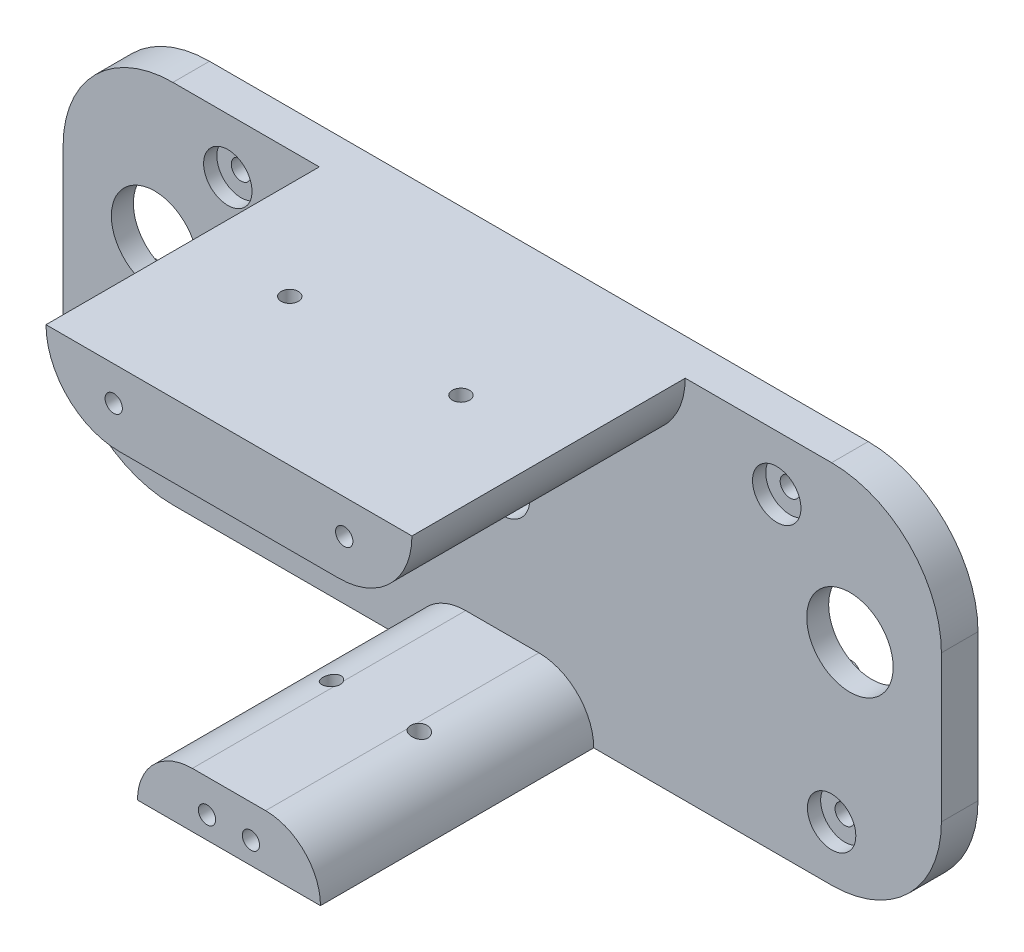
from build123d import *

# Parameters (mm, degrees)
BOSS_EXTRUDE1_DEPTH                              = 3.175
SKETCH2_W                                        = 31.75
SKETCH2_H                                        = 9.525
BOSS_EXTRUDE2_DEPTH                              = 47.419999902
SKETCH3_R                                        = 1.5
CUT_EXTRUDE1_DEPTH                               = 12.7
SKETCH6_R                                        = 1.5
CUT_EXTRUDE2_DEPTH                               = 12.7
SKETCH7_R                                        = 1.5
CUT_EXTRUDE3_DEPTH                               = 12.7
FILLET1_R                                        = 9.525
SKETCH12_R                                       = 7.5
CUT_EXTRUDE4_DEPTH                               = 101.032629802
CUT_EXTRUDE5_START                               = -2.54
CUT_EXTRUDE5_DEPTH                               = 2.54
FILLET3_R                                        = 1.5875
FILLET3_OF_MIRROR2_R                             = 1.5875
CBORE_FOR_M3_HEX_HEAD_MACHINE_SCREW1_D           = 3.4
CBORE_FOR_M3_HEX_HEAD_MACHINE_SCREW1_CBORE_D     = 8.4
CBORE_FOR_M3_HEX_HEAD_MACHINE_SCREW1_CBORE_DEPTH = 2.3
SKETCH19_R                                       = 4.7625
CUT_EXTRUDE6_DEPTH                               = 101.032629802


with BuildPart() as part:
    # Sketch1 → Boss-Extrude1 (new, symmetric)
    with BuildSketch(Plane.XY):
        with BuildLine():
            Line((-57.15, 44.175), (57.15, 44.175))
            ThreePointArc((57.15, 44.175), (70.620384182, 38.595384182), (76.2, 25.125))
            Line((76.2, 25.125), (76.2, -0.275))
            ThreePointArc((76.2, -0.275), (70.620384182, -13.745384182), (57.15, -19.325))
            Line((57.15, -19.325), (-57.15, -19.325))
            ThreePointArc((-57.15, -19.325), (-70.620384182, -13.745384182), (-76.2, -0.275))
            Line((-76.2, -0.275), (-76.2, 25.125))
            ThreePointArc((-76.2, 25.125), (-70.620384182, 38.595384182), (-57.15, 44.175))
        make_face()
    extrude(amount=BOSS_EXTRUDE1_DEPTH, both=True)

    # Sketch2 → Boss-Extrude2 (add)
    with BuildSketch(Plane(origin=(0, 0, 3.175), x_dir=(-1, 0, 0), z_dir=(0, 0, -1))):
        with BuildLine():
            Line((-31.75, 44.175), (31.75, 44.175))
            ThreePointArc((31.75, 44.175), (28.030256121, 35.194743879), (19.05, 31.475))
            Line((19.05, 31.475), (-19.05, 31.475))
            ThreePointArc((-19.05, 31.475), (-28.030256121, 35.194743879), (-31.75, 44.175))
        make_face()
        with Locations((0, -14.5625)):
            Rectangle(SKETCH2_W, SKETCH2_H)
    extrude(amount=-BOSS_EXTRUDE2_DEPTH)

    # Sketch3 → Cut-Extrude1 (cut)
    with BuildSketch(Plane.XY.offset(50.594999902)):
        with Locations((-20, 38.225)):
            Circle(SKETCH3_R)
        with Locations((20, 38.225)):
            Circle(SKETCH3_R)
        with Locations((-3.81, -15.515)):
            Circle(SKETCH3_R)
        with Locations((3.81, -15.515)):
            Circle(SKETCH3_R)
    extrude(amount=-CUT_EXTRUDE1_DEPTH, mode=Mode.SUBTRACT)

    # Sketch6 → Cut-Extrude2 (cut)
    with BuildSketch(Plane(origin=(0, 44.175, 0), x_dir=(1, 0, 0), z_dir=(0, 1, 0))):
        with Locations(Location((-14.85, -25.194999902, 0), (0, 0, 270))):
            Circle(SKETCH6_R)
        with Locations(Location((14.85, -25.194999902, 0), (0, 0, 90))):
            Circle(SKETCH6_R)
    extrude(amount=-CUT_EXTRUDE2_DEPTH, mode=Mode.SUBTRACT)

    # Sketch7 → Cut-Extrude3 (cut)
    with BuildSketch(Plane.XZ.offset(19.325)):
        with Locations(Location((-7.6199916, 25.194999902, 0), (0, 0, 270))):
            Circle(SKETCH7_R)
        with Locations(Location((7.6199916, 25.194999902, 0), (0, 0, 212.149655394))):
            Circle(SKETCH7_R)
    extrude(amount=-CUT_EXTRUDE3_DEPTH, mode=Mode.SUBTRACT)

    # Fillet1
    # the kernel refuses this fillet: 9.525 mm, written as the material it takes off along each edge
    with BuildSketch(Plane(origin=(-15.875, -9.8, 3.175), x_dir=(0, -1, 0), z_dir=(0, 0, 1)), Plane(origin=(15.875, -9.8, 3.175), x_dir=(-1, 0, 0), z_dir=(0, 0, 1))) as fillet1_piece_1:
        with BuildLine():
            CenterArc((FILLET1_R, FILLET1_R), FILLET1_R, 180, 90)
            Line((0, FILLET1_R), (-FILLET1_R * 0.02, FILLET1_R))
            Line((-FILLET1_R * 0.02, FILLET1_R), (-FILLET1_R * 0.02, -FILLET1_R * 0.02))
            Line((-FILLET1_R * 0.02, -FILLET1_R * 0.02), (FILLET1_R, -FILLET1_R * 0.02))
            Line((FILLET1_R, -FILLET1_R * 0.02), (FILLET1_R, 0))
        make_face()
    extrude(amount=47.419999902, mode=Mode.SUBTRACT)

    # Sketch12 → Cut-Extrude4 (cut, through all)
    with BuildSketch(Plane.XY.offset(3.175)):
        with Locations((60.325, 18.775)):
            Circle(SKETCH12_R)
        with Locations((-60.325, 18.775)):
            Circle(SKETCH12_R)
    extrude(amount=-CUT_EXTRUDE4_DEPTH, mode=Mode.SUBTRACT)

    # Sketch14 → Cut-Extrude5 (cut)
    with BuildSketch(Plane(origin=(0, 0, -3.175), x_dir=(-1, 0, 0), z_dir=(0, 0, -1)).offset(CUT_EXTRUDE5_START)):
        with BuildLine():
            ThreePointArc((-67.36426696, 21.363188685), (-66.820190528, 22.525), (-66.086070631, 23.577089669))
            Line((-66.086070631, 23.577089669), (-65.244148963, 27.295215935))
            Line((-65.244148963, 27.295215935), (-71.386034831, 29.201296117))
            ThreePointArc((-71.386034831, 29.201296117), (-75.556221789, 27.56875), (-74.88495472, 23.140989098))
            Line((-74.88495472, 23.140989098), (-70.163297927, 18.775))
            Line((-70.163297927, 18.775), (-67.36426696, 21.363188685))
        make_face()
        with BuildLine():
            Line((-65.244148963, 27.295215935), (-66.086070631, 23.577089669))
            ThreePointArc((-66.086070631, 23.577089669), (-64.075, 25.270190528), (-61.603196329, 26.165278354))
            Line((-61.603196329, 26.165278354), (-65.244148963, 27.295215935))
        make_face()
        with BuildLine():
            Line((-63.823919889, 33.567285215), (-65.244148963, 27.295215935))
            Line((-65.244148963, 27.295215935), (-61.603196329, 26.165278354))
            ThreePointArc((-61.603196329, 26.165278354), (-60.325, 26.275), (-59.046803671, 26.165278354))
            Line((-59.046803671, 26.165278354), (-55.405851037, 27.295215935))
            Line((-55.405851037, 27.295215935), (-56.826080111, 33.567285215))
            ThreePointArc((-56.826080111, 33.567285215), (-60.325, 36.3625), (-63.823919889, 33.567285215))
        make_face()
        with BuildLine():
            Line((-55.405851037, 27.295215935), (-59.046803671, 26.165278354))
            ThreePointArc((-59.046803671, 26.165278354), (-56.575, 25.270190528), (-54.563929369, 23.577089669))
            Line((-54.563929369, 23.577089669), (-55.405851037, 27.295215935))
        make_face()
        with BuildLine():
            Line((-49.263965169, 29.201296117), (-55.405851037, 27.295215935))
            Line((-55.405851037, 27.295215935), (-54.563929369, 23.577089669))
            ThreePointArc((-54.563929369, 23.577089669), (-53.829809472, 22.525), (-53.28573304, 21.363188685))
            Line((-53.28573304, 21.363188685), (-50.486702073, 18.775))
            Line((-50.486702073, 18.775), (-45.76504528, 23.140989098))
            ThreePointArc((-45.76504528, 23.140989098), (-45.093778211, 27.56875), (-49.263965169, 29.201296117))
        make_face()
        with BuildLine():
            Line((-50.486702073, 18.775), (-53.28573304, 21.363188685))
            ThreePointArc((-53.28573304, 21.363188685), (-52.941081589, 20.089438626), (-52.825, 18.775))
            ThreePointArc((-52.825, 18.775), (-52.941081589, 17.460561374), (-53.28573304, 16.186811315))
            Line((-53.28573304, 16.186811315), (-50.486702073, 18.775))
        make_face()
        with BuildLine():
            Line((-45.76504528, 14.409010902), (-50.486702073, 18.775))
            Line((-50.486702073, 18.775), (-53.28573304, 16.186811315))
            ThreePointArc((-53.28573304, 16.186811315), (-53.829809472, 15.025), (-54.563929369, 13.972910331))
            Line((-54.563929369, 13.972910331), (-55.405851037, 10.254784065))
            Line((-55.405851037, 10.254784065), (-49.263965169, 8.348703883))
            ThreePointArc((-49.263965169, 8.348703883), (-45.093778211, 9.98125), (-45.76504528, 14.409010902))
        make_face()
        with BuildLine():
            ThreePointArc((-54.563929369, 13.972910331), (-56.575, 12.279809472), (-59.046803671, 11.384721646))
            Line((-59.046803671, 11.384721646), (-55.405851037, 10.254784065))
            Line((-55.405851037, 10.254784065), (-54.563929369, 13.972910331))
        make_face()
        with BuildLine():
            Line((-61.603196329, 11.384721646), (-65.244148963, 10.254784065))
            Line((-65.244148963, 10.254784065), (-63.823919889, 3.982714785))
            ThreePointArc((-63.823919889, 3.982714785), (-60.325, 1.1875), (-56.826080111, 3.982714785))
            Line((-56.826080111, 3.982714785), (-55.405851037, 10.254784065))
            Line((-55.405851037, 10.254784065), (-59.046803671, 11.384721646))
            ThreePointArc((-59.046803671, 11.384721646), (-60.325, 11.275), (-61.603196329, 11.384721646))
        make_face()
        with BuildLine():
            ThreePointArc((-61.603196329, 11.384721646), (-64.075, 12.279809472), (-66.086070631, 13.972910331))
            Line((-66.086070631, 13.972910331), (-65.244148963, 10.254784065))
            Line((-65.244148963, 10.254784065), (-61.603196329, 11.384721646))
        make_face()
        with BuildLine():
            Line((-67.36426696, 16.186811315), (-70.163297927, 18.775))
            Line((-70.163297927, 18.775), (-74.88495472, 14.409010902))
            ThreePointArc((-74.88495472, 14.409010902), (-75.556221789, 9.98125), (-71.386034831, 8.348703883))
            Line((-71.386034831, 8.348703883), (-65.244148963, 10.254784065))
            Line((-65.244148963, 10.254784065), (-66.086070631, 13.972910331))
            ThreePointArc((-66.086070631, 13.972910331), (-66.820190528, 15.025), (-67.36426696, 16.186811315))
        make_face()
        with BuildLine():
            ThreePointArc((-67.36426696, 16.186811315), (-67.825, 18.775), (-67.36426696, 21.363188685))
            Line((-67.36426696, 21.363188685), (-70.163297927, 18.775))
            Line((-70.163297927, 18.775), (-67.36426696, 16.186811315))
        make_face()
    cut_extrude5 = extrude(amount=CUT_EXTRUDE5_DEPTH, mode=Mode.SUBTRACT)

    # Fillet3
    fillet3_edges = [part.edges().sort_by_distance(p)[0] for p in [
        (65.244148963, 27.295215935, -1.905),
        (55.405851037, 27.295215935, -1.905),
        (50.486702073, 18.775, -1.905),
        (55.405851037, 10.254784065, -1.905),
        (65.244148963, 10.254784065, -1.905),
        (70.163297927, 18.775, -1.905),
    ]]
    fillet(fillet3_edges, radius=FILLET3_R)

    # Mirror2: Cut-Extrude5 across plane
    add(cut_extrude5.mirror(Plane(origin=(0, 0, 0), x_dir=(0, 0, 1), z_dir=(1, 0, 0))), mode=Mode.SUBTRACT)

    # Fillet3 of Mirror2
    fillet3_of_mirror2_edges = [part.edges().sort_by_distance(p)[0] for p in [
        (-65.244148963, 27.295215935, -1.905),
        (-55.405851037, 27.295215935, -1.905),
        (-50.486702073, 18.775, -1.905),
        (-55.405851037, 10.254784065, -1.905),
        (-65.244148963, 10.254784065, -1.905),
        (-70.163297927, 18.775, -1.905),
    ]]
    fillet(fillet3_of_mirror2_edges, radius=FILLET3_OF_MIRROR2_R)

    # CBORE for M3 Hex Head Machine Screw1 (through all)
    with Locations(Plane.XY.offset(3.175)):
        with Locations((-47.625, 34.65), (-57.15, -9.8), (57.15, -9.8), (47.625, 34.65)):
            CounterBoreHole(CBORE_FOR_M3_HEX_HEAD_MACHINE_SCREW1_D / 2, CBORE_FOR_M3_HEX_HEAD_MACHINE_SCREW1_CBORE_D / 2, CBORE_FOR_M3_HEX_HEAD_MACHINE_SCREW1_CBORE_DEPTH)

    # Sketch19 → Cut-Extrude6 (cut, through all)
    with BuildSketch(Plane.XY.offset(3.175)):
        with Locations((0, 12.425)):
            Circle(SKETCH19_R)
    extrude(amount=-CUT_EXTRUDE6_DEPTH, mode=Mode.SUBTRACT)


solid = part.part
